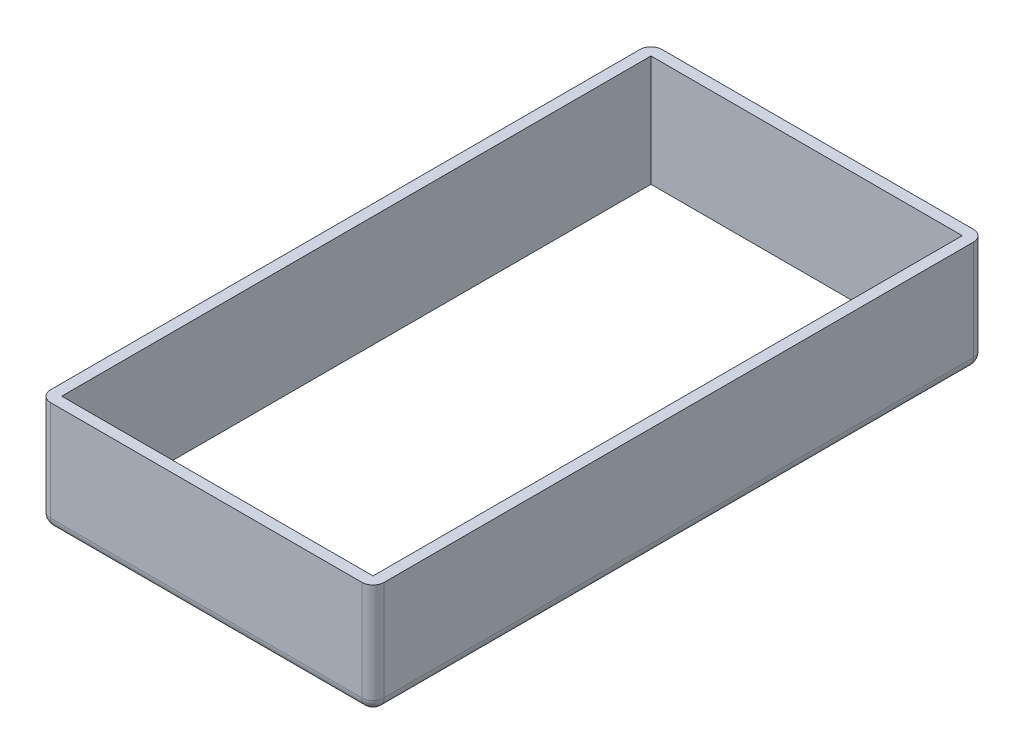
from build123d import *

# Parameters (mm, degrees)
SKETCH1_W           = 76.2
SKETCH1_H           = 139.7
BOSS_EXTRUDE1_DEPTH = 25.4
FILLET1_R           = 2.54
SHELL1_START        = -110.973034188
SHELL1_OUTLINE_W    = 20.32
SHELL1_OUTLINE_H    = 134.62
SHELL1_DEPTH        = 71.12
SKETCH5_W           = 71.12
SKETCH5_H           = 134.62
CUT_EXTRUDE1_DEPTH  = 25.4


# Read off the part's stored shape, not the designer's step: Shell1
with BuildPart() as part:
    # Sketch1 → Boss-Extrude1 (new body)
    with BuildSketch(Plane(origin=(0, 0, 0), x_dir=(1, 0, 0), z_dir=(0, 1, 0))):
        with Locations((-75.413034188, -14.477457265)):
            Rectangle(SKETCH1_W, SKETCH1_H)
    extrude(amount=BOSS_EXTRUDE1_DEPTH)

    # Fillet1
    fillet1_edges = [part.edges().sort_by_distance(p)[0] for p in [
        (-75.413034188, 0, -55.372542735),
        (-37.313034188, 0, 14.477457265),
        (-75.413034188, 0, 84.327457265),
        (-113.513034188, 0, 14.477457265),
        (-113.513034188, 12.7, -55.372542735),
        (-37.313034188, 12.7, -55.372542735),
        (-37.313034188, 12.7, 84.327457265),
        (-113.513034188, 12.7, 84.327457265),
    ]]
    fillet(fillet1_edges, radius=FILLET1_R)

    # Shell1 outline → Shell1 (cut)
    with BuildSketch(Plane.YZ.offset(SHELL1_START)):
        with Locations((12.7, 14.477457265)):
            Rectangle(SHELL1_OUTLINE_W, SHELL1_OUTLINE_H)
    extrude(amount=SHELL1_DEPTH, mode=Mode.SUBTRACT)

    # Sketch5 → Cut-Extrude1 (cut)
    with BuildSketch(Plane(origin=(0, 25.4, 0), x_dir=(1, 0, 0), z_dir=(0, 1, 0))):
        with Locations((-75.413034188, -14.477457265)):
            Rectangle(SKETCH5_W, SKETCH5_H)
    extrude(amount=-CUT_EXTRUDE1_DEPTH, mode=Mode.SUBTRACT)


solid = part.part
